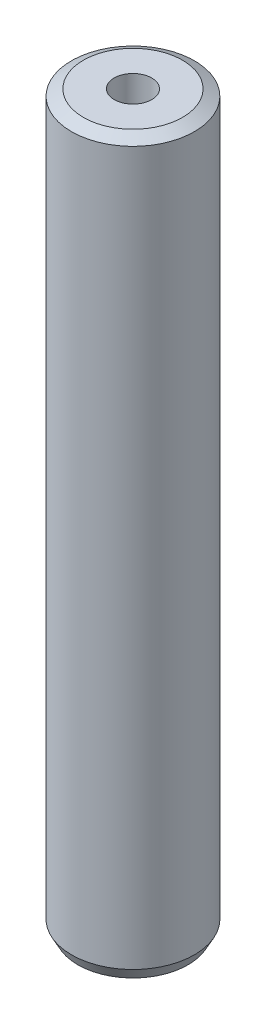
from build123d import *
from OCP.BRepFilletAPI import BRepFilletAPI_MakeChamfer

# Parameters (mm, degrees)
SKETCH1_R           = 22.5
BOSS_EXTRUDE1_DEPTH = 267.630387029
SKETCH2_R           = 6.874875387
CUT_EXTRUDE1_DEPTH  = 270.515350325
CHAMFER1_SIZE       = 2.341664633
CHAMFER1_SIZE2      = 4.35188523


with BuildPart() as part:
    # Sketch1 → Boss-Extrude1 (new body)
    with BuildSketch(Plane(origin=(0, 0, 0), x_dir=(1, 0, 0), z_dir=(0, 1, 0))):
        Circle(SKETCH1_R)
    extrude(amount=BOSS_EXTRUDE1_DEPTH)

    # Sketch2 → Cut-Extrude1 (cut, through all)
    with BuildSketch(Plane(origin=(0, 0, 0), x_dir=(1, 0, 0), z_dir=(0, 1, 0))):
        Circle(SKETCH2_R)
    extrude(amount=CUT_EXTRUDE1_DEPTH, mode=Mode.SUBTRACT)

    # Chamfer1: one chamfer whose edges measure the first distance from different faces: ONE call of the kernel's chamfer builder (chamfer() names one face for all edges)
    chamfer1_edges_1 = [part.edges().sort_by_distance(p)[0] for p in [
        (-22.5, 267.630387029, 0),
    ]]
    chamfer1_side_1 = [part.faces().sort_by_distance(p)[0] for p in [
        (-22.5, 133.815193514, 0),
    ]]
    chamfer1_edges_2 = [part.edges().sort_by_distance(p)[0] for p in [
        (-22.5, 0, 0),
    ]]
    chamfer1_side_2 = [part.faces().sort_by_distance(p)[0] for p in [
        (-21.863603897, 0, 0),
    ]]
    chamfer1 = BRepFilletAPI_MakeChamfer(part.part.solid().wrapped)
    for e in chamfer1_edges_1:
        chamfer1.Add(CHAMFER1_SIZE, CHAMFER1_SIZE2, e.wrapped, chamfer1_side_1[0].wrapped)  # the first distance lies on this face
    for e in chamfer1_edges_2:
        chamfer1.Add(CHAMFER1_SIZE, CHAMFER1_SIZE2, e.wrapped, chamfer1_side_2[0].wrapped)  # the first distance lies on this face
    add(Compound.cast(chamfer1.Shape()), mode=Mode.REPLACE)


solid = part.part
